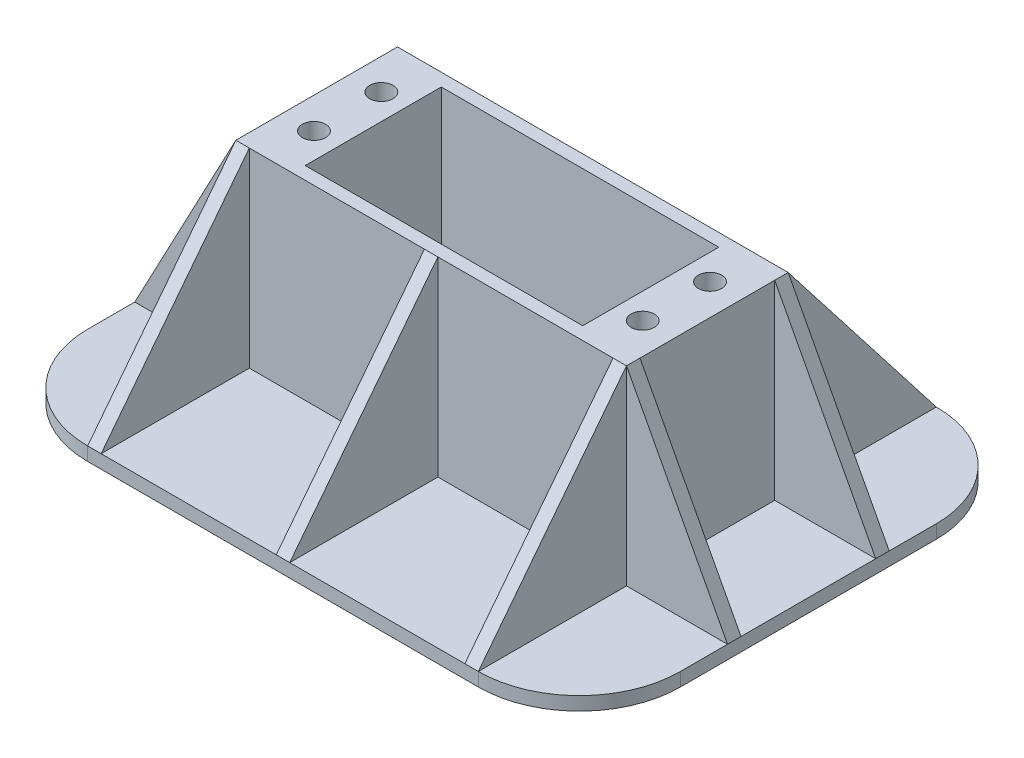
from build123d import *

# Parameters (mm, degrees)
SKETCH1_W                 = 58
SKETCH1_H                 = 24
BOSS_EXTRUDE1_DEPTH       = 28.3
SKETCH2_W                 = 88
SKETCH2_H                 = 68
BOSS_EXTRUDE2_DEPTH       = 2
SKETCH12_W                = 41.2
SKETCH12_H                = 20.2
CUT_EXTRUDE1_DEPTH        = 27.95
BOSS_EXTRUDE6_DEPTH       = 2
LPATTERN2_COUNT           = 3
LPATTERN2_PITCH           = 28
BOSS_EXTRUDE7_DEPTH       = 2
LPATTERN3_COUNT           = 2
LPATTERN3_PITCH           = 22
SKETCH17_R                = 1
CUT_EXTRUDE2_DEPTH        = 10
F_8_32_TAPPED_HOLE1_D     = 3.4544
F_8_32_TAPPED_HOLE1_DEPTH = 12
F_8_32_TAPPED_HOLE1_TIP   = 1.037806461
FILLET1_R                 = 15
FILLET2_R                 = 15
FILLET3_R                 = 15
FILLET5_R                 = 15


with BuildPart() as part:
    # Sketch1 → Boss-Extrude1 (new body)
    with BuildSketch(Plane(origin=(0, 0, 0), x_dir=(1, 0, 0), z_dir=(0, 1, 0))):
        Rectangle(SKETCH1_W, SKETCH1_H)
    extrude(amount=BOSS_EXTRUDE1_DEPTH)

    # Sketch2 → Boss-Extrude2 (add)
    with BuildSketch(Plane.XZ):
        Rectangle(SKETCH2_W, SKETCH2_H)
    extrude(amount=BOSS_EXTRUDE2_DEPTH)

    # Sketch12 → Cut-Extrude1 (cut)
    with BuildSketch(Plane(origin=(0, 28.3, 0), x_dir=(1, 0, 0), z_dir=(0, 1, 0))):
        Rectangle(SKETCH12_W, SKETCH12_H)
    extrude(amount=-CUT_EXTRUDE1_DEPTH, mode=Mode.SUBTRACT)

    # Sketch14 → Boss-Extrude6 (add)
    with BuildSketch(Plane.ZY.offset(29)):
        Polygon((-12, 28.3), (-12, 0), (-34, 0), align=None)
        Polygon((12, 28.3), (12, 0), (34, 0), align=None)
    boss_extrude6 = extrude(amount=-BOSS_EXTRUDE6_DEPTH)

    # LPattern2: Boss-Extrude6 ×3
    with Locations(*[(i * LPATTERN2_PITCH, 0, 0) for i in range(1, LPATTERN2_COUNT)]):
        add(boss_extrude6)

    # Sketch16 → Boss-Extrude7 (add)
    with BuildSketch(Plane(origin=(0, 0, -12), x_dir=(-1, 0, 0), z_dir=(0, 0, -1))):
        Polygon((-29, 28.3), (-44, 0), (-29, 0), align=None)
        Polygon((29, 28.3), (29, 0), (44, 0), align=None)
    boss_extrude7 = extrude(amount=-BOSS_EXTRUDE7_DEPTH)

    # LPattern3: Boss-Extrude7 ×2
    with Locations(*[(0, 0, i * LPATTERN3_PITCH) for i in range(1, LPATTERN3_COUNT)]):
        add(boss_extrude7)

    # Sketch17 → Cut-Extrude2 (cut)
    with BuildSketch(Plane(origin=(0, 28.3, 0), x_dir=(1, 0, 0), z_dir=(0, 1, 0))):
        with Locations((-24.4, 5)):
            Circle(SKETCH17_R)
        with Locations((-24.4, -5)):
            Circle(SKETCH17_R)
        with Locations((24.4, -5)):
            Circle(SKETCH17_R)
        with Locations((24.4, 5)):
            Circle(SKETCH17_R)
    extrude(amount=-CUT_EXTRUDE2_DEPTH, mode=Mode.SUBTRACT)

    # #8-32 Tapped Hole1
    with Locations(Plane(origin=(-24.4, 28.3, -5), x_dir=(0, 0, 1), z_dir=(0, 1, 0))):
        with Locations((0, 0), (10, 0), (0, 48.8), (10, 48.8)):
            Hole(F_8_32_TAPPED_HOLE1_D / 2, depth=F_8_32_TAPPED_HOLE1_DEPTH)
            with Locations((0, 0, -(F_8_32_TAPPED_HOLE1_DEPTH + F_8_32_TAPPED_HOLE1_TIP / 2))):  # 118° drill point
                Cone(0, F_8_32_TAPPED_HOLE1_D / 2, F_8_32_TAPPED_HOLE1_TIP, mode=Mode.SUBTRACT)

    # Fillet1
    fillet1_edges = [part.edges().sort_by_distance(p)[0] for p in [
        (-44, -1, 34),
    ]]
    fillet(fillet1_edges, radius=FILLET1_R)

    # Fillet2
    fillet2_edges = [part.edges().sort_by_distance(p)[0] for p in [
        (44, -1, 34),
    ]]
    fillet(fillet2_edges, radius=FILLET2_R)

    # Fillet3
    fillet3_edges = [part.edges().sort_by_distance(p)[0] for p in [
        (44, -1, -34),
    ]]
    fillet(fillet3_edges, radius=FILLET3_R)

    # Fillet5
    fillet5_edges = [part.edges().sort_by_distance(p)[0] for p in [
        (-44, -1, -34),
    ]]
    fillet(fillet5_edges, radius=FILLET5_R)


solid = part.part
